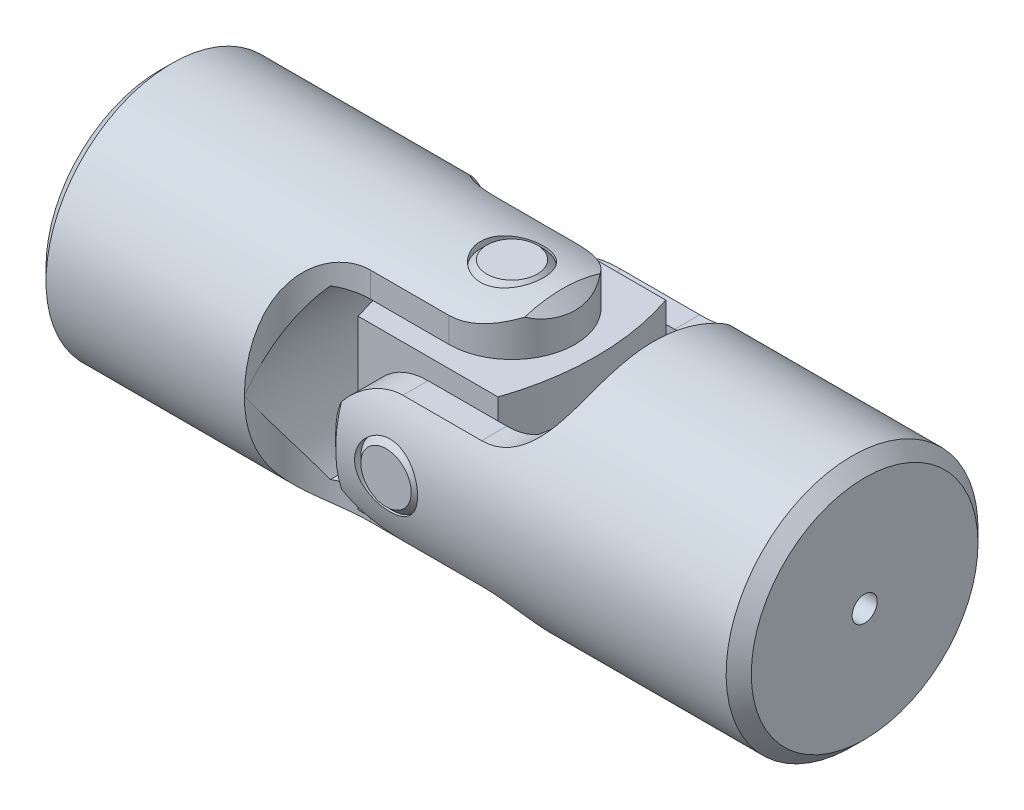
from build123d import *

# Parameters (mm, degrees)
CHAMFER1_SIZE         = 3.175
EXTRUDE1_DEPTH        = 100.595858348
EXTRUDE1_DEPTH_BACK   = 100.595858348
EXTRUDE3_DEPTH        = 100.595858411
EXTRUDE3_DEPTH_BACK   = 100.595858411
SKETCH4_R             = 3.175
EXTRUDE4_DEPTH        = 6.35
EXTRUDE6_DEPTH        = 100.595858411
EXTRUDE6_DEPTH_BACK   = 100.595858411
SKETCH6_R             = 7.9375
BODY_MOVE_COPY1_ANGLE = 90
EXTRUDE10_START       = -21.1455
EXTRUDE10_OUTLINE_W   = 42.291
EXTRUDE10_OUTLINE_H   = 42.291
EXTRUDE10_DEPTH       = 42.291
CUT_EXTRUDE2_DEPTH    = 109.209086666
EXTRUDE13_DEPTH       = 100.595858411
EXTRUDE13_DEPTH_BACK  = 100.595858411
SKETCH13_R            = 7.9375
SKETCH14_R            = 7.9375
EXTRUDE14_DEPTH       = 31.75
EXTRUDE15_DEPTH       = 100.595858411
EXTRUDE15_DEPTH_BACK  = 100.595858411
SKETCH15_R            = 7.9375
SKETCH16_R            = 7.9375
EXTRUDE16_DEPTH       = 31.75
CHAMFER3_SIZE         = 1.5875


# Read off the part's stored shape, not the designer's step: Extrude10
with BuildPart() as part:
    # Sketch1 → Revolve1 (revolve)
    with BuildSketch(Plane(origin=(0, 0, 0), x_dir=(1, 0, 0), z_dir=(0, 1, 0)), mode=Mode.PRIVATE) as revolve1_sk:
        Polygon((-88.9, 31.75), (-35.71875, 31.75), (15.875, 31.75), (15.875, 0), (-88.9, 0), align=None)
    revolve(revolve1_sk.sketch.rotate(Axis((-88.9, 0, 0), (1, 0, 0)), 180), axis=Axis((-88.9, 0, 0), (1, 0, 0)))

    # Chamfer1
    chamfer1_edges = [part.edges().sort_by_distance(p)[0] for p in [
        (15.875, 0, -31.75),
        (-88.9, 0, -31.75),
    ]]
    chamfer(chamfer1_edges, length=CHAMFER1_SIZE)

    # Sketch2 → Extrude1 (cut, two sides: drawn at the far end of the back side and taken through both)
    with BuildSketch(Plane(origin=(0, 0, 0), x_dir=(1, 0, 0), z_dir=(0, 1, 0)).offset(-EXTRUDE1_DEPTH_BACK)):
        with BuildLine():
            Line((-35.7124, 31.75), (31.75, 31.75))
            Line((31.75, 31.75), (31.75, -31.75))
            Line((31.75, -31.75), (-35.7124, -31.75))
            ThreePointArc((-35.7124, -31.75), (-31.062720151, -20.524679849), (-19.8374, -15.875))
            Line((-19.8374, -15.875), (0, -15.875))
            ThreePointArc((0, -15.875), (15.875, 0), (0, 15.875))
            Line((0, 15.875), (-19.8374, 15.875))
            ThreePointArc((-19.8374, 15.875), (-31.062720151, 20.524679849), (-35.7124, 31.75))
        make_face()
    extrude(amount=EXTRUDE1_DEPTH + EXTRUDE1_DEPTH_BACK, mode=Mode.SUBTRACT)

    # Sketch3 → Extrude3 (cut, two sides: drawn at the far end of the back side and taken through both)
    with BuildSketch(Plane.XY.offset(-EXTRUDE3_DEPTH_BACK)):
        with BuildLine():
            Line((-27.7749, 21.1455), (31.75, 21.1455))
            Line((31.75, 21.1455), (31.75, -21.1455))
            Line((31.75, -21.1455), (-27.7749, -21.1455))
            ThreePointArc((-27.7749, -21.1455), (-35.7124, 0), (-27.7749, 21.1455))
        make_face()
    extrude(amount=EXTRUDE3_DEPTH + EXTRUDE3_DEPTH_BACK, mode=Mode.SUBTRACT)

    # Sketch4 → Extrude4 (cut)
    with BuildSketch(Plane.ZY.offset(88.9)):
        Circle(SKETCH4_R)
    extrude(amount=-EXTRUDE4_DEPTH, mode=Mode.SUBTRACT)

    # Extrude5 cone 1 section (through the dimple's axis) → Extrude5 (revolve, cut)
    with BuildSketch(Plane(origin=(-82.55, 0, 0), x_dir=(0, 0, 1), z_dir=(0, 1, 0))):
        Polygon((0, 0), (3.175, 0), (0, 3.175), align=None)
    revolve(axis=Axis((-82.55, 0, 0), (1, 0, 0)), mode=Mode.SUBTRACT)

    # Sketch6 → Extrude6 (cut, two sides: drawn at the far end of the back side and taken through both)
    with BuildSketch(Plane(origin=(0, 0, 0), x_dir=(1, 0, 0), z_dir=(0, 1, 0)).offset(-EXTRUDE6_DEPTH_BACK)):
        with Locations(Location((0, 0, 0), (0, 0, 270))):
            Circle(SKETCH6_R)
    extrude(amount=EXTRUDE6_DEPTH + EXTRUDE6_DEPTH_BACK, mode=Mode.SUBTRACT)


with BuildPart() as body_2:
    # Mirror1: mirrored copy
    add(part.part.mirror(Plane(origin=(0, 0, 0), x_dir=(0, 0, 1), z_dir=(1, 0, 0))))


with BuildPart() as body_2_1:
    # Body-Move/Copy1: moved
    add(body_2.part.rotate(Axis((0, 0, 0), (1, 0, 0)), BODY_MOVE_COPY1_ANGLE))


with BuildPart() as body_3:
    # Extrude10 outline → Extrude10 (new body)
    with BuildSketch(Plane.XY.offset(EXTRUDE10_START)):
        Rectangle(EXTRUDE10_OUTLINE_W, EXTRUDE10_OUTLINE_H)
    extrude(amount=EXTRUDE10_DEPTH)

    # Sketch20 → Cut-Extrude2 (cut, through all)
    with BuildSketch(Plane(origin=(0, 21.1455, 0), x_dir=(1, 0, 0), z_dir=(0, 1, 0))):
        with BuildLine():
            Line((22.1615, -22.1615), (22.1615, 22.1615))
            Line((22.1615, 22.1615), (17.62125, 22.1615))
            Line((17.62125, 22.1615), (17.62125, 21.1455))
            ThreePointArc((17.62125, 21.1455), (21.1455, 0), (17.62125, -21.1455))
            Line((17.62125, -21.1455), (17.62125, -22.1615))
            Line((17.62125, -22.1615), (22.1615, -22.1615))
        make_face()
        with BuildLine():
            Line((-22.1615, 22.1615), (-22.1615, -22.1615))
            Line((-22.1615, -22.1615), (-17.62125, -22.1615))
            Line((-17.62125, -22.1615), (-17.62125, -21.1455))
            ThreePointArc((-17.62125, -21.1455), (-21.1455, 0), (-17.62125, 21.1455))
            Line((-17.62125, 21.1455), (-17.62125, 22.1615))
            Line((-17.62125, 22.1615), (-22.1615, 22.1615))
        make_face()
    extrude(amount=-CUT_EXTRUDE2_DEPTH, mode=Mode.SUBTRACT)

    # Sketch13 → Extrude13 (cut, two sides: drawn at the far end of the back side and taken through both)
    with BuildSketch(Plane(origin=(0, 0, 0), x_dir=(1, 0, 0), z_dir=(0, 1, 0)).offset(-EXTRUDE13_DEPTH_BACK)):
        with Locations(Location((0, 0, 0), (0, 0, 270))):
            Circle(SKETCH13_R)
    extrude(amount=EXTRUDE13_DEPTH + EXTRUDE13_DEPTH_BACK, mode=Mode.SUBTRACT)

    # Sketch15 → Extrude15 (cut, two sides: drawn at the far end of the back side and taken through both)
    with BuildSketch(Plane.XY.offset(-EXTRUDE15_DEPTH_BACK)):
        Circle(SKETCH15_R)
    extrude(amount=EXTRUDE15_DEPTH + EXTRUDE15_DEPTH_BACK, mode=Mode.SUBTRACT)


with BuildPart() as body_4:
    # Sketch14 → Extrude14 (new, symmetric)
    with BuildSketch(Plane(origin=(0, 0, 0), x_dir=(1, 0, 0), z_dir=(0, 1, 0))):
        with Locations(Location((0, 0, 0), (0, 0, 270))):
            Circle(SKETCH14_R)
    extrude(amount=EXTRUDE14_DEPTH, both=True)

    # Sketch16 → Extrude16 (add, symmetric)
    with BuildSketch(Plane.XY):
        Circle(SKETCH16_R)
    extrude(amount=EXTRUDE16_DEPTH, both=True)

    # Chamfer3
    chamfer3_edges = [body_4.edges().sort_by_distance(p)[0] for p in [
        (0, -31.75, -7.9375),
        (0, 31.75, -7.9375),
        (-7.9375, 0, -31.75),
        (-7.9375, 0, 31.75),
    ]]
    chamfer(chamfer3_edges, length=CHAMFER3_SIZE)


solid = Compound([part.part, body_2_1.part, body_3.part, body_4.part])
